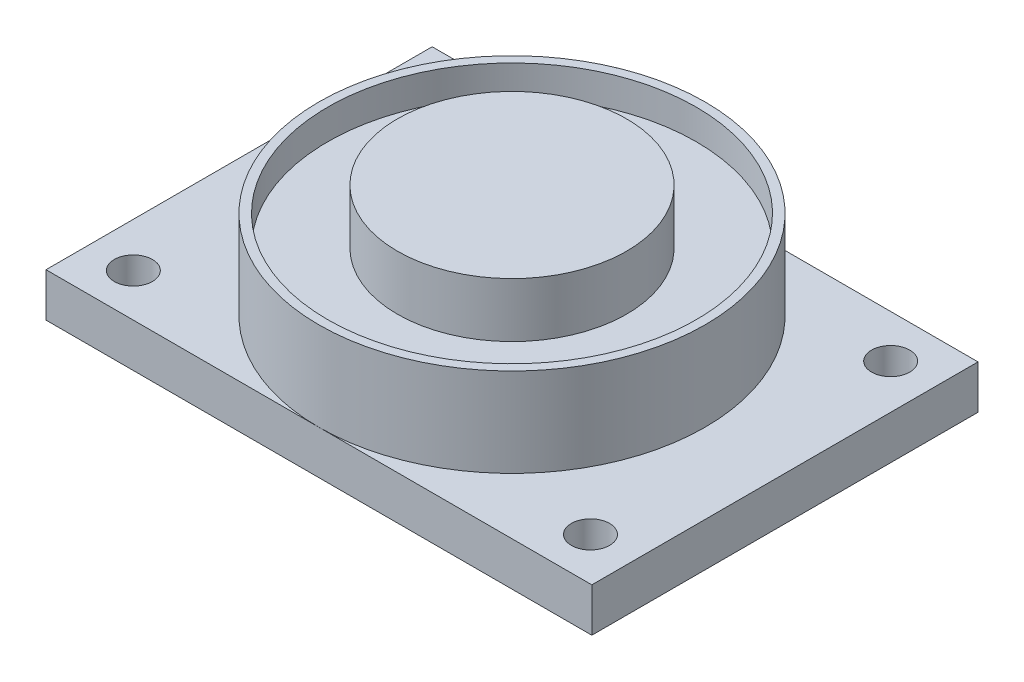
from build123d import *

# Parameters (mm, degrees)
SKETCH_1_W          = 40
SKETCH_1_H          = 28.3
EXTRUDE_1_DEPTH     = 3.2
SKETCH_1_3_R        = 14.15
EXTRUDE_2_DEPTH     = 6.5
SKETCH_1_4_R        = 1.4
CUT_EXTRUDE_1_DEPTH = 6.5
SKETCH_2_R          = 13.5
SKETCH_2_R_2        = 8.4
CUT_EXTRUDE_2_DEPTH = 2.2
EXTRUDE_START       = 1.8
SKETCH_2_2_R        = 8.4
EXTRUDE_3_DEPTH     = 4
CUT_EXTRUDE_3_DEPTH = 0.2
CUT_EXTRUDE_4_DEPTH = 1
EXTRUDE_5_DEPTH     = 1
CUT_EXTRUDE_7_DEPTH = 1
CUT_EXTRUDE_7_DRAFT = -60
SKETCH_4_14_R       = 7.5
EXTRUDE_6_DEPTH     = 1
SKETCH_4_15_R       = 7.5
CUT_EXTRUDE_8_DEPTH = 1
CUT_EXTRUDE_8_DRAFT = -60
SKETCH_4_16_R       = 5.9
EXTRUDE_7_DEPTH     = 1
FILLET_2_R          = 10
FILLET_3_R          = 1
FILLET_4_R          = 0.2
FILLET_5_R          = 2


with BuildPart() as part:
    # Эскиз1 → Бобышка-Вытянуть1 (new body)
    with BuildSketch(Plane(origin=(0, 0, 0), x_dir=(1, 0, 0), z_dir=(0, 1, 0))):
        Rectangle(SKETCH_1_W, SKETCH_1_H)
    extrude(amount=-EXTRUDE_1_DEPTH)

    # Эскиз1<3> → Бобышка-Вытянуть2 (add)
    with BuildSketch(Plane(origin=(0, 0, 0), x_dir=(1, 0, 0), z_dir=(0, 1, 0))):
        with Locations(Location((0, 0, 0), (0, 0, 270))):
            Circle(SKETCH_1_3_R)
    extrude(amount=EXTRUDE_2_DEPTH)

    # Эскиз1<4> → Вырез-Вытянуть1 (cut)
    with BuildSketch(Plane(origin=(0, 0, 0), x_dir=(1, 0, 0), z_dir=(0, 1, 0))):
        with Locations(Location((-16.75, 11, 0), (0, 0, 270))):
            Circle(SKETCH_1_4_R)
        with Locations(Location((16.75, 11, 0), (0, 0, 270))):
            Circle(SKETCH_1_4_R)
        with Locations(Location((16.75, -11, 0), (0, 0, 270))):
            Circle(SKETCH_1_4_R)
        with Locations(Location((-16.75, -11, 0), (0, 0, 270))):
            Circle(SKETCH_1_4_R)
    extrude(amount=-CUT_EXTRUDE_1_DEPTH, mode=Mode.SUBTRACT)

    # Эскиз2 → Вырез-Вытянуть2 (cut)
    with BuildSketch(Plane(origin=(0, 6.5, 0), x_dir=(1, 0, 0), z_dir=(0, 1, 0))):
        with Locations(Location((0, 0, 0), (0, 0, 270))):
            Circle(SKETCH_2_R)
        with Locations(Location((0, 0, 0), (0, 0, 270))):
            Circle(SKETCH_2_R_2, mode=Mode.SUBTRACT)
    extrude(amount=-CUT_EXTRUDE_2_DEPTH, mode=Mode.SUBTRACT)

    # Эскиз2<2> → Бобышка-Вытянуть3 (add)
    with BuildSketch(Plane(origin=(0, 6.5, 0), x_dir=(1, 0, 0), z_dir=(0, 1, 0)).offset(EXTRUDE_START)):
        with Locations(Location((0, 0, 0), (0, 0, 270))):
            Circle(SKETCH_2_2_R)
    extrude(amount=-EXTRUDE_3_DEPTH)

    # Эскиз4 → Вырез-Вытянуть3 (cut)
    with BuildSketch(Plane.XZ.offset(3.2)):
        with BuildLine():
            Line((5.925, -13.325), (-5.925, -13.325))
            ThreePointArc((-5.925, -13.325), (-19.25, 0), (-5.925, 13.325))
            Line((-5.925, 13.325), (5.925, 13.325))
            ThreePointArc((5.925, 13.325), (19.25, 0), (5.925, -13.325))
        make_face()
    extrude(amount=-CUT_EXTRUDE_3_DEPTH, mode=Mode.SUBTRACT)

    # Эскиз4<3> → Вырез-Вытянуть4 (cut)
    with BuildSketch(Plane.XZ.offset(3.2)):
        with BuildLine():
            Line((5.925, -11.325), (-5.925, -11.325))
            ThreePointArc((-5.925, -11.325), (-17.25, 0), (-5.925, 11.325))
            Line((-5.925, 11.325), (5.925, 11.325))
            ThreePointArc((5.925, 11.325), (17.25, 0), (5.925, -11.325))
        make_face()
    extrude(amount=-CUT_EXTRUDE_4_DEPTH, mode=Mode.SUBTRACT)

    # Эскиз4<12> → Бобышка-Вытянуть5 (add)
    with BuildSketch(Plane.XZ.offset(3.2)):
        with BuildLine():
            Line((5.925, -7.825), (-5.925, -7.825))
            ThreePointArc((-5.925, -7.825), (-13.75, 0), (-5.925, 7.825))
            Line((-5.925, 7.825), (5.925, 7.825))
            ThreePointArc((5.925, 7.825), (13.75, 0), (5.925, -7.825))
        make_face()
    extrude(amount=-EXTRUDE_5_DEPTH)


with BuildPart() as cut_extrude_7_tool:
    # Эскиз4<13> → Вырез-Вытянуть7 (with draft: the straight prism first)
    with BuildSketch(Plane.XZ.offset(3.2)):
        with BuildLine():
            ThreePointArc((5.925, -7.825), (13.75, 0), (5.925, 7.825))
            Line((5.925, 7.825), (-5.925, 7.825))
            ThreePointArc((-5.925, 7.825), (-13.75, 0), (-5.925, -7.825))
            Line((-5.925, -7.825), (5.925, -7.825))
        make_face()
    extrude(amount=-CUT_EXTRUDE_7_DEPTH)
    # Вырез-Вытянуть7: the draft: its side faces are tilted about the plane it starts from
    cut_extrude_7_sides = [cut_extrude_7_tool.faces().sort_by_distance(p)[0] for p in [
        (13.75, -2.7, 0),
        (0, -2.7, 7.825),
        (-13.75, -2.7, 0),
        (0, -2.7, -7.825),
    ]]
    draft(cut_extrude_7_sides, Plane.XZ.offset(3.2), CUT_EXTRUDE_7_DRAFT)


with BuildPart() as part_1:
    add(part.part)

    # Вырез-Вытянуть7: cut by cut_extrude_7_tool
    add(cut_extrude_7_tool.part, mode=Mode.SUBTRACT)

    # Эскиз4<14> → Бобышка-Вытянуть6 (add)
    with BuildSketch(Plane.XZ.offset(3.2)):
        with Locations(Location((0, 0, 0), (0, 0, 270))):
            Circle(SKETCH_4_14_R)
    extrude(amount=-EXTRUDE_6_DEPTH)


with BuildPart() as cut_extrude_8_tool:
    # Эскиз4<15> → Вырез-Вытянуть8 (with draft: the straight prism first)
    with BuildSketch(Plane.XZ.offset(3.2)):
        with Locations(Location((0, 0, 0), (0, 0, 270))):
            Circle(SKETCH_4_15_R)
    extrude(amount=-CUT_EXTRUDE_8_DEPTH)
    # Вырез-Вытянуть8: the draft: its side faces are tilted about the plane it starts from
    cut_extrude_8_sides = [cut_extrude_8_tool.faces().sort_by_distance(p)[0] for p in [
        (0, -2.7, 7.5),
    ]]
    draft(cut_extrude_8_sides, Plane.XZ.offset(3.2), CUT_EXTRUDE_8_DRAFT)


with BuildPart() as part_2:
    add(part_1.part)

    # Вырез-Вытянуть8: cut by cut_extrude_8_tool
    add(cut_extrude_8_tool.part, mode=Mode.SUBTRACT)

    # Эскиз4<16> → Бобышка-Вытянуть7 (add)
    with BuildSketch(Plane.XZ.offset(3.2)):
        with Locations(Location((0, 0, 0), (0, 0, 270))):
            Circle(SKETCH_4_16_R)
    extrude(amount=-EXTRUDE_7_DEPTH)

    # Скругление2
    # the kernel refuses this fillet: 10 mm, written as the material it takes off along each edge
    with BuildSketch(Plane(origin=(0, -3.2, 0), x_dir=(0, 0, -1), z_dir=(-1, 0, 0))) as fillet_2_piece_1:
        with BuildLine():
            CenterArc((1.702158259, -10), FILLET_2_R, 65.179037751, 24.820962249)
            Line((1.702158259, 0), (1.702158259, 0.2))
            Line((1.702158259, 0.2), (5.9, 0.2))
            Line((5.9, 0.2), (6.1, 0))
            ThreePointArc((6.1, 0), (6.1, -0.461880215), (5.983956835, -0.742235639))
            Line((5.983956835, -0.742235639), (5.9, -0.923760431))
        make_face()
    revolve(axis=Axis((0, -3.2, 0), (0, -1, 0)), mode=Mode.SUBTRACT)

    # Скругление3
    # the kernel refuses this fillet: 1 mm, written as the material it adds along each edge
    with BuildSketch(Plane(origin=(-5.925, -2.2, 7.825), x_dir=(0, 0, 1), z_dir=(1, 0, 0)), Plane(origin=(5.925, -2.2, -7.825), x_dir=(0, 0, -1), z_dir=(-1, 0, 0))) as fillet_3_piece_1:
        with BuildLine():
            CenterArc((FILLET_3_R, FILLET_3_R), FILLET_3_R, 180, 90)
            Line((0, FILLET_3_R), (0, 0))
            Line((0, 0), (FILLET_3_R, 0))
        make_face()
    extrude(amount=11.85)
    with BuildSketch(Plane(origin=(5.925, -2.2, 0), x_dir=(0, 0, 1), z_dir=(-1, 0, 0))) as fillet_3_piece_2:
        with BuildLine():
            CenterArc((7.825 + FILLET_3_R, -FILLET_3_R), FILLET_3_R, 90, 90)
            Line((7.825, -FILLET_3_R), (7.825, 0))
            Line((7.825, 0), (7.825 + FILLET_3_R, 0))
        make_face()
    revolve(axis=Axis((5.925, -2.2, 0), (0, 1, 0)), revolution_arc=180)
    with BuildSketch(Plane(origin=(-5.925, -2.2, 11.325), x_dir=(0, -1.0, -1.5609735726224723e-12), z_dir=(1, 0, 0)), Plane(origin=(5.925, -2.2, -11.325), x_dir=(0, -1.0, 1.5631940186717218e-12), z_dir=(-1, 0, 0))) as fillet_3_piece_3:
        with BuildLine():
            CenterArc((1, 0.979795897), FILLET_3_R, 180, 78.463040967)
            Line((0, 0.979795897), (0, 0))
            Line((0, 0), (0.8, 0))
        make_face()
    extrude(amount=11.85)
    with BuildSketch(Plane(origin=(5.925, -2.2, 0), x_dir=(0, 0, 1), z_dir=(-1, 0, 0))) as fillet_3_piece_4:
        with BuildLine():
            CenterArc((10.345204103, -1), FILLET_3_R, 11.536959033, 78.463040967)
            Line((10.345204103, 0), (11.325, 0))
            Line((11.325, 0), (11.325, -0.8))
        make_face()
    revolve(axis=Axis((5.925, -2.2, 0), (0, 1, 0)), revolution_arc=180)
    with BuildSketch(Plane(origin=(-5.925, -2.2, 0), x_dir=(0, 0, -1), z_dir=(1, 0, 0))) as fillet_3_piece_5:
        with BuildLine():
            CenterArc((7.825 + FILLET_3_R, -FILLET_3_R), FILLET_3_R, 90, 90)
            Line((7.825, -FILLET_3_R), (7.825, 0))
            Line((7.825, 0), (7.825 + FILLET_3_R, 0))
        make_face()
    revolve(axis=Axis((-5.925, -2.2, 0), (0, 1, 0)), revolution_arc=180)
    with BuildSketch(Plane(origin=(-5.925, -2.2, 0), x_dir=(0, 0, -1), z_dir=(1, 0, 0))) as fillet_3_piece_6:
        with BuildLine():
            CenterArc((10.345204103, -1), FILLET_3_R, 11.536959033, 78.463040967)
            Line((10.345204103, 0), (11.325, 0))
            Line((11.325, 0), (11.325, -0.8))
        make_face()
    revolve(axis=Axis((-5.925, -2.2, 0), (0, 1, 0)), revolution_arc=180)

    # Скругление4
    fillet_4_edges = [part_2.edges().sort_by_distance(p)[0] for p in [
        (0, -3.2, 7.5),
        (17.25, -3, 0),
        (0, -3, 11.325),
        (-17.25, -3, 0),
        (0, -3, -11.325),
        (0, -3.2, -7.825),
        (0, -3.2, 7.825),
        (-13.75, -3.2, 0),
        (13.75, -3.2, 0),
    ]]
    fillet(fillet_4_edges, radius=FILLET_4_R)

    # Скругление5
    fillet_5_edges = [part_2.edges().sort_by_distance(p)[0] for p in [
        (5.149162419, -2.2, -6.092949192),
        (5.149162419, -2.2, 6.092949192),
        (-5.149162419, -2.2, 6.092949192),
        (-5.149162419, -2.2, -6.092949192),
        (12.017949192, -2.2, 0),
        (-12.017949192, -2.2, 0),
    ]]
    fillet(fillet_5_edges, radius=FILLET_5_R)


solid = part_2.part
